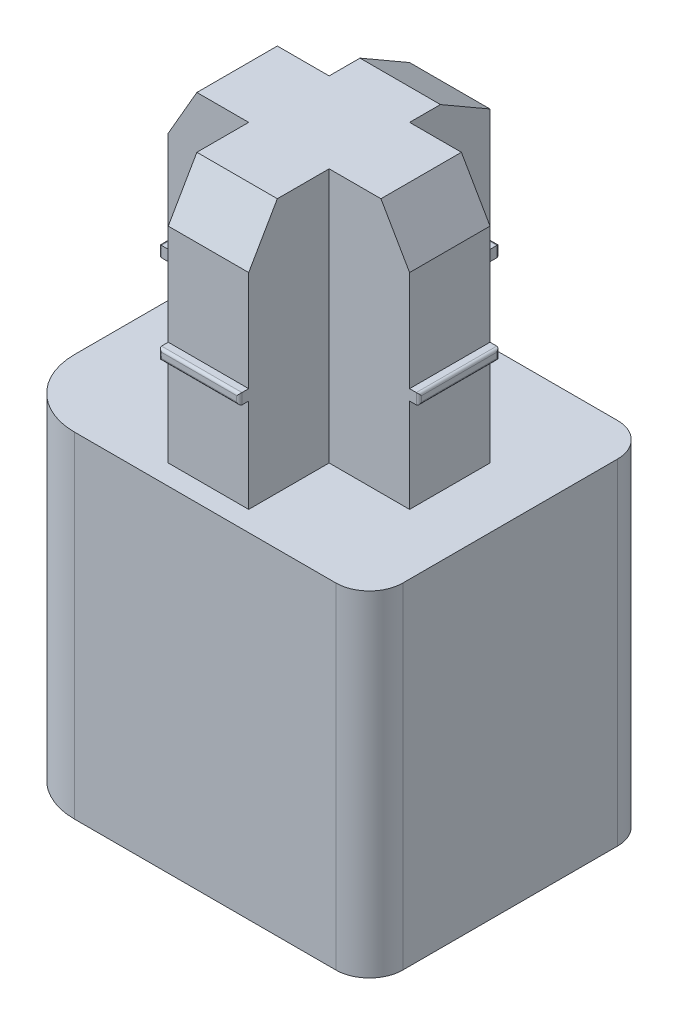
from build123d import *
from OCP.BRepFilletAPI import BRepFilletAPI_MakeChamfer

# Parameters (mm, degrees)
SKETCH1_W           = 6.858
SKETCH1_H           = 5.334
BOSS_EXTRUDE1_DEPTH = 6.35
SKETCH2_W           = 1.524
SKETCH2_H           = 1.524
BOSS_EXTRUDE2_DEPTH = 4.826
CHAMFER1_SIZE       = 0.9398
CHAMFER1_SIZE2      = 0.542593783
BOSS_EXTRUDE3_START = -3.048
SKETCH3_W           = 0.720393783
SKETCH3_H           = 1.524
SKETCH3_W_2         = 0.981406217
SKETCH3_W_3         = 1.524
SKETCH3_H_2         = 1.1176
SKETCH3_H_3         = 0.5842
SKETCH3_H_4         = 0.981406217
SKETCH3_H_5         = 0.720393783
BOSS_EXTRUDE3_DEPTH = 0.2032
SKETCH4_W           = 1.397
SKETCH4_H           = 1.524
SKETCH4_W_2         = 1.524
SKETCH4_H_2         = 1.397
CUT_EXTRUDE1_DEPTH  = 3.556
SKETCH5_W           = 1.524
SKETCH5_H           = 1.143
BOSS_EXTRUDE4_DEPTH = 0.254
FILLET1_R           = 0.127
FILLET2_R           = 0.0508
FILLET3_R           = 0.635
FILLET4_R           = 0.254
FILLET5_R           = 0.254
FILLET6_R           = 1.27


with BuildPart() as part:
    # Sketch1 → Boss-Extrude1 (new body)
    with BuildSketch(Plane(origin=(0, 0, 0), x_dir=(1, 0, 0), z_dir=(0, 1, 0))):
        Rectangle(SKETCH1_W, SKETCH1_H)
    extrude(amount=BOSS_EXTRUDE1_DEPTH)

    # Sketch2 → Boss-Extrude2 (add)
    with BuildSketch(Plane(origin=(0, 6.35, 0), x_dir=(1, 0, 0), z_dir=(0, 1, 0))):
        Rectangle(SKETCH2_W, SKETCH2_H)
        with Locations((1.524, 0)):
            Rectangle(SKETCH2_W, SKETCH2_H)
        with Locations((0, 1.524)):
            Rectangle(SKETCH2_W, SKETCH2_H)
        with Locations((-1.524, 0)):
            Rectangle(SKETCH2_W, SKETCH2_H)
        with Locations((0, -1.524)):
            Rectangle(SKETCH2_W, SKETCH2_H)
    extrude(amount=BOSS_EXTRUDE2_DEPTH)

    # Chamfer1: one chamfer whose edges measure the first distance from different faces: ONE call of the kernel's chamfer builder (chamfer() names one face for all edges)
    chamfer1_edges_1 = [part.edges().sort_by_distance(p)[0] for p in [
        (2.286, 11.176, 0),
    ]]
    chamfer1_side_1 = [part.faces().sort_by_distance(p)[0] for p in [
        (2.286, 8.763, 0),
    ]]
    chamfer1_edges_2 = [part.edges().sort_by_distance(p)[0] for p in [
        (0, 11.176, -2.286),
    ]]
    chamfer1_side_2 = [part.faces().sort_by_distance(p)[0] for p in [
        (0, 11.176, 0),
    ]]
    chamfer1_edges_3 = [part.edges().sort_by_distance(p)[0] for p in [
        (-2.286, 11.176, 0),
    ]]
    chamfer1_side_3 = [part.faces().sort_by_distance(p)[0] for p in [
        (-2.286, 8.763, 0),
    ]]
    chamfer1_edges_4 = [part.edges().sort_by_distance(p)[0] for p in [
        (0, 11.176, 2.286),
    ]]
    chamfer1_side_4 = [part.faces().sort_by_distance(p)[0] for p in [
        (0, 8.763, 2.286),
    ]]
    chamfer1 = BRepFilletAPI_MakeChamfer(part.part.solid().wrapped)
    for e in chamfer1_edges_1:
        chamfer1.Add(CHAMFER1_SIZE, CHAMFER1_SIZE2, e.wrapped, chamfer1_side_1[0].wrapped)  # the first distance lies on this face
    for e in chamfer1_edges_2:
        chamfer1.Add(CHAMFER1_SIZE, CHAMFER1_SIZE2, e.wrapped, chamfer1_side_2[0].wrapped)  # the first distance lies on this face
    for e in chamfer1_edges_3:
        chamfer1.Add(CHAMFER1_SIZE, CHAMFER1_SIZE2, e.wrapped, chamfer1_side_3[0].wrapped)  # the first distance lies on this face
    for e in chamfer1_edges_4:
        chamfer1.Add(CHAMFER1_SIZE, CHAMFER1_SIZE2, e.wrapped, chamfer1_side_4[0].wrapped)  # the first distance lies on this face
    add(Compound.cast(chamfer1.Shape()), mode=Mode.REPLACE)

    # Sketch3 → Boss-Extrude3 (add)
    with BuildSketch(Plane(origin=(0, 11.176, 0), x_dir=(1, 0, 0), z_dir=(0, 1, 0)).offset(BOSS_EXTRUDE3_START)):
        with Locations((2.103603109, 0)):
            Rectangle(SKETCH3_W, SKETCH3_H)
        with Locations((1.252703108, 0)):
            Rectangle(SKETCH3_W_2, SKETCH3_H)
        with Locations((0, 1.905)):
            Rectangle(SKETCH3_W_3, SKETCH3_H_2)
        with Locations((0, 1.0541)):
            Rectangle(SKETCH3_W_3, SKETCH3_H_3)
        Rectangle(SKETCH3_W_3, SKETCH3_H)
        with Locations((-1.252703108, 0)):
            Rectangle(SKETCH3_W_2, SKETCH3_H)
        with Locations((-2.103603109, 0)):
            Rectangle(SKETCH3_W, SKETCH3_H)
        with Locations((0, -1.252703108)):
            Rectangle(SKETCH3_W_3, SKETCH3_H_4)
        with Locations((0, -2.103603109)):
            Rectangle(SKETCH3_W_3, SKETCH3_H_5)
    extrude(amount=BOSS_EXTRUDE3_DEPTH)

    # Sketch4 → Cut-Extrude1 (cut)
    with BuildSketch(Plane.XZ):
        with Locations((-1.4605, 0)):
            Rectangle(SKETCH4_W, SKETCH4_H)
        Rectangle(SKETCH4_W_2, SKETCH4_H)
        with Locations((1.4605, 0)):
            Rectangle(SKETCH4_W, SKETCH4_H)
        with Locations((0, -1.4605)):
            Rectangle(SKETCH4_W_2, SKETCH4_H_2)
        with Locations((0, 1.4605)):
            Rectangle(SKETCH4_W_2, SKETCH4_H_2)
    extrude(amount=-CUT_EXTRUDE1_DEPTH, mode=Mode.SUBTRACT)

    # Sketch5 → Boss-Extrude4 (add)
    with BuildSketch(Plane(origin=(0, 0, 2.159), x_dir=(-1, 0, 0), z_dir=(0, 0, -1))):
        with Locations((0, 2.3495)):
            Rectangle(SKETCH5_W, SKETCH5_H)
    extrude(amount=BOSS_EXTRUDE4_DEPTH)

    # Fillet1
    fillet1_edges = [part.edges().sort_by_distance(p)[0] for p in [
        (0, 1.778, 1.905),
        (0, 2.921, 1.905),
    ]]
    fillet(fillet1_edges, radius=FILLET1_R)

    # Fillet2
    fillet2_edges = [part.edges().sort_by_distance(p)[0] for p in [
        (-2.4638, 8.3312, 0),
        (0, 8.3312, 2.4638),
        (2.4638, 8.128, 0),
        (2.4638, 8.3312, 0),
        (2.4638, 8.2296, 0.762),
        (2.4638, 8.2296, -0.762),
        (0, 8.3312, -2.4638),
        (0.762, 8.2296, -2.4638),
        (-0.762, 8.2296, -2.4638),
        (-2.4638, 8.128, 0),
        (-2.4638, 8.2296, -0.762),
        (0, 8.128, 2.4638),
        (-0.762, 8.2296, 2.4638),
        (0, 8.128, -2.4638),
        (-2.4638, 8.2296, 0.762),
        (0.762, 8.2296, 2.4638),
    ]]
    fillet(fillet2_edges, radius=FILLET2_R)

    # Fillet3
    fillet3_edges = [part.edges().sort_by_distance(p)[0] for p in [
        (3.429, 3.175, 2.667),
        (-3.429, 3.175, -2.667),
        (3.429, 3.175, -2.667),
    ]]
    fillet(fillet3_edges, radius=FILLET3_R)

    # Fillet4
    fillet4_edges = [part.edges().sort_by_distance(p)[0] for p in [
        (-1.4605, 0, -0.762),
        (-2.159, 0, 0),
        (0.762, 0, 1.4605),
        (1.4605, 0, -0.762),
        (0.762, 0, -1.4605),
        (0, 0, -2.159),
        (-0.762, 0, -1.4605),
        (2.159, 0, 0),
        (1.4605, 0, 0.762),
        (0, 0, 2.159),
        (-0.762, 0, 1.4605),
        (-1.4605, 0, 0.762),
    ]]
    fillet(fillet4_edges, radius=FILLET4_R)

    # Fillet5
    # the kernel refuses this fillet: 0.254 mm, written as the material it takes off along each edge
    with BuildSketch(Plane(origin=(1.016, 0.254, -1.016), x_dir=(0, 0, 1), z_dir=(-1, 0, 0))) as fillet5_piece_1_section:
        Polygon((0, 0), (FILLET5_R, 0), (FILLET5_R, -FILLET5_R), (0, -FILLET5_R), align=None)
    fillet5_piece_1 = extrude(amount=FILLET5_R, mode=Mode.PRIVATE)
    fillet5_piece_1 = fillet5_piece_1 - Plane(origin=(1.016, 0.254, -1.016), x_dir=(0, 0.7071067811865475, -0.7071067811865475), z_dir=(-1, 0, 0)) * Sphere(FILLET5_R, mode=Mode.PRIVATE)
    add(fillet5_piece_1, mode=Mode.SUBTRACT)
    with BuildSketch(Plane(origin=(1.016, 0.254, 1.016), x_dir=(0, 0, -1), z_dir=(-1, 0, 0))) as fillet5_piece_2_section:
        Polygon((0, 0), (FILLET5_R, 0), (FILLET5_R, FILLET5_R), (0, FILLET5_R), align=None)
    fillet5_piece_2 = extrude(amount=FILLET5_R, mode=Mode.PRIVATE)
    fillet5_piece_2 = fillet5_piece_2 - Plane(origin=(1.016, 0.254, 1.016), x_dir=(0, 0.7071067811865475, 0.7071067811865475), z_dir=(-1, 0, 0)) * Sphere(FILLET5_R, mode=Mode.PRIVATE)
    add(fillet5_piece_2, mode=Mode.SUBTRACT)
    with BuildSketch(Plane(origin=(-1.016, 0.254, -1.016), x_dir=(1, 0, 0), z_dir=(0, 0, 1))) as fillet5_piece_3_section:
        Polygon((0, 0), (FILLET5_R, 0), (FILLET5_R, -FILLET5_R), (0, -FILLET5_R), align=None)
    fillet5_piece_3 = extrude(amount=FILLET5_R, mode=Mode.PRIVATE)
    fillet5_piece_3 = fillet5_piece_3 - Plane(origin=(-1.016, 0.254, -1.016), x_dir=(-0.7071067811865475, 0.7071067811865475, 0), z_dir=(0, 0, 1)) * Sphere(FILLET5_R, mode=Mode.PRIVATE)
    add(fillet5_piece_3, mode=Mode.SUBTRACT)
    with BuildSketch(Plane(origin=(-1.016, 0.254, 1.016), x_dir=(1, 0, 0), z_dir=(0, 0, -1))) as fillet5_piece_4_section:
        Polygon((0, 0), (FILLET5_R, 0), (FILLET5_R, FILLET5_R), (0, FILLET5_R), align=None)
    fillet5_piece_4 = extrude(amount=FILLET5_R, mode=Mode.PRIVATE)
    fillet5_piece_4 = fillet5_piece_4 - Plane(origin=(-1.016, 0.254, 1.016), x_dir=(-0.7071067811865475, 0.7071067811865475, 0), z_dir=(0, 0, -1)) * Sphere(FILLET5_R, mode=Mode.PRIVATE)
    add(fillet5_piece_4, mode=Mode.SUBTRACT)
    with BuildSketch(Plane(origin=(-0.762, 0.254, -0.762), x_dir=(-1, 0, 0), z_dir=(0, 1, 0)), Plane(origin=(0.762, 0.254, -0.762), x_dir=(0, 0, -1), z_dir=(0, 1, 0))) as fillet5_piece_5:
        with BuildLine():
            CenterArc((FILLET5_R, -FILLET5_R), FILLET5_R, 90, 90)
            Line((0, -FILLET5_R), (0, 0))
            Line((0, 0), (FILLET5_R, 0))
        make_face()
    extrude(amount=3.302, mode=Mode.SUBTRACT)
    with BuildSketch(Plane(origin=(-0.762, 0.254, 0.762), x_dir=(-1, 0, 0), z_dir=(0, 1, 0)), Plane(origin=(0.762, 0.254, 0.762), x_dir=(0, 0, 1), z_dir=(0, 1, 0))) as fillet5_piece_6:
        with BuildLine():
            CenterArc((FILLET5_R, FILLET5_R), FILLET5_R, 180, 90)
            Line((0, FILLET5_R), (0, 0))
            Line((0, 0), (FILLET5_R, 0))
        make_face()
    extrude(amount=3.302, mode=Mode.SUBTRACT)

    # Fillet6
    fillet6_edges = [part.edges().sort_by_distance(p)[0] for p in [
        (-3.429, 3.175, 2.667),
    ]]
    fillet(fillet6_edges, radius=FILLET6_R)


solid = part.part
